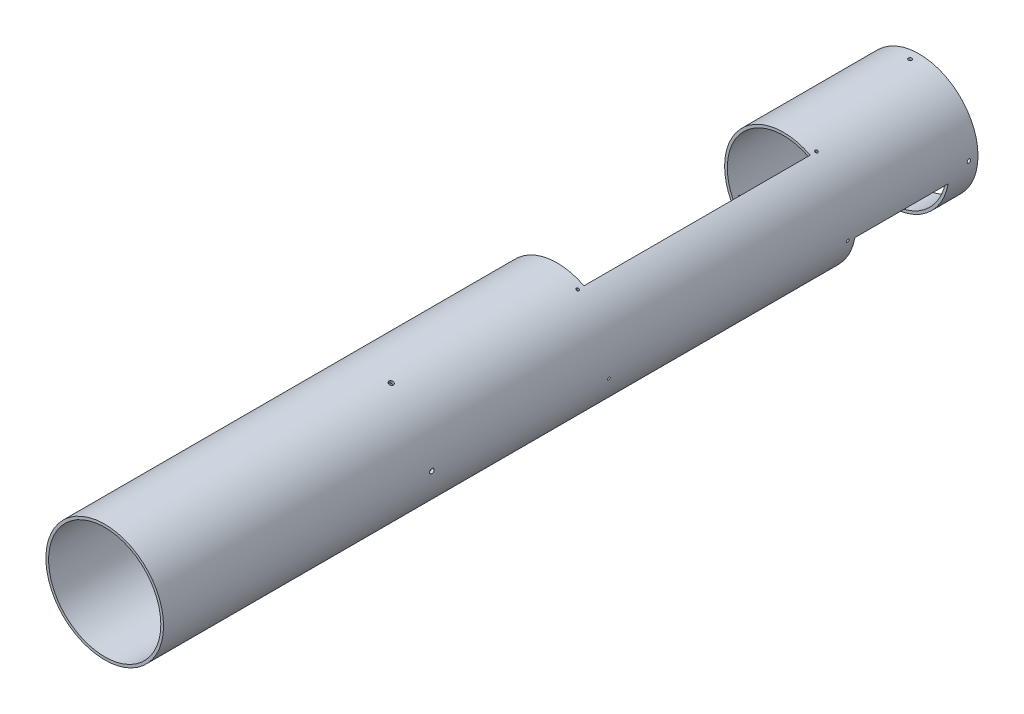
from build123d import *

# Parameters (mm, degrees)
SKETCH1_R           = 65
SKETCH1_R_2         = 62
BOSS_EXTRUDE1_DEPTH = 900
SKETCH4_W           = 130
SKETCH4_H           = 250
CUT_EXTRUDE4_DEPTH  = 516
SKETCH5_R           = 2
CUT_EXTRUDE5_DEPTH  = 85
CIRPATTERN1_COUNT   = 4
SKETCH7_R           = 1.5
CUT_EXTRUDE6_DEPTH  = 243
CIRPATTERN2_COUNT   = 5
SKETCH8_R           = 2.5
CUT_EXTRUDE7_DEPTH  = 209
CIRPATTERN3_COUNT   = 5
CUT_EXTRUDE8_START  = -103
CUT_EXTRUDE8_DEPTH  = 103


with BuildPart() as part:
    # Sketch1 → Boss-Extrude1 (new body)
    with BuildSketch(Plane.XY):
        Circle(SKETCH1_R)
        Circle(SKETCH1_R_2, mode=Mode.SUBTRACT)
    extrude(amount=BOSS_EXTRUDE1_DEPTH)

    # Sketch4 → Cut-Extrude4 (cut)
    with BuildSketch(Plane(origin=(-14.142135624, 14.142135624, 0), x_dir=(0.7071067811865477, 0.7071067811865475, 0), z_dir=(-0.7071067811865475, 0.7071067811865477, 0))):
        with Locations((0, -275)):
            Rectangle(SKETCH4_W, SKETCH4_H)
    extrude(amount=CUT_EXTRUDE4_DEPTH, mode=Mode.SUBTRACT)

    # Sketch5 → Cut-Extrude5 (cut)
    with BuildSketch(Plane(origin=(0, 0, 0), x_dir=(1, 0, 0), z_dir=(0, 1, 0))):
        with Locations((0, -10)):
            Circle(SKETCH5_R)
    cut_extrude5 = extrude(amount=-CUT_EXTRUDE5_DEPTH, mode=Mode.SUBTRACT)

    # CirPattern1: Cut-Extrude5 ×4 about axis
    cirpattern1_axis = Axis((0, 0, 900), (0, 0, -1))
    for i in range(1, CIRPATTERN1_COUNT):
        add(cut_extrude5.rotate(cirpattern1_axis, i * 360 / CIRPATTERN1_COUNT), mode=Mode.SUBTRACT)

    # Sketch7 → Cut-Extrude6 (cut)
    with BuildSketch(Plane(origin=(-14.142135624, 14.142135624, 0), x_dir=(0.7071067811865477, 0.7071067811865475, 0), z_dir=(-0.7071067811865475, 0.7071067811865477, 0))):
        with Locations((0, -143)):
            Circle(SKETCH7_R)
        with Locations((0, -407)):
            Circle(SKETCH7_R)
    cut_extrude6 = extrude(amount=CUT_EXTRUDE6_DEPTH, mode=Mode.SUBTRACT)

    # CirPattern2: Cut-Extrude6 ×5 about axis
    cirpattern2_axis = Axis((0, 0, 900), (0, 0, -1))
    for i in range(1, CIRPATTERN2_COUNT):
        add(cut_extrude6.rotate(cirpattern2_axis, i * 360 / CIRPATTERN2_COUNT), mode=Mode.SUBTRACT)

    # Sketch8 → Cut-Extrude7 (cut)
    with BuildSketch(Plane(origin=(0, 0, 0), x_dir=(0, 0, -1), z_dir=(1, 0, 0))):
        with Locations((-603.5, 0)):
            Circle(SKETCH8_R)
    cut_extrude7 = extrude(amount=CUT_EXTRUDE7_DEPTH, mode=Mode.SUBTRACT)

    # CirPattern3: Cut-Extrude7 ×5 about axis
    cirpattern3_axis = Axis((0, 0, 900), (0, 0, -1))
    for i in range(1, CIRPATTERN3_COUNT):
        add(cut_extrude7.rotate(cirpattern3_axis, i * 360 / CIRPATTERN3_COUNT), mode=Mode.SUBTRACT)

    # Sketch9 → Cut-Extrude8 (cut)
    with BuildSketch(Plane.XY.offset(135).offset(CUT_EXTRUDE8_START)):
        with BuildLine():
            Line((0, 0), (11.287131548, -64.012503946))
            ThreePointArc((11.287131548, -64.012503946), (45.961940777, -45.961940777), (64.012503946, -11.287131548))
            Line((64.012503946, -11.287131548), (0, 0))
        make_face()
    extrude(amount=CUT_EXTRUDE8_DEPTH, mode=Mode.SUBTRACT)


solid = part.part
